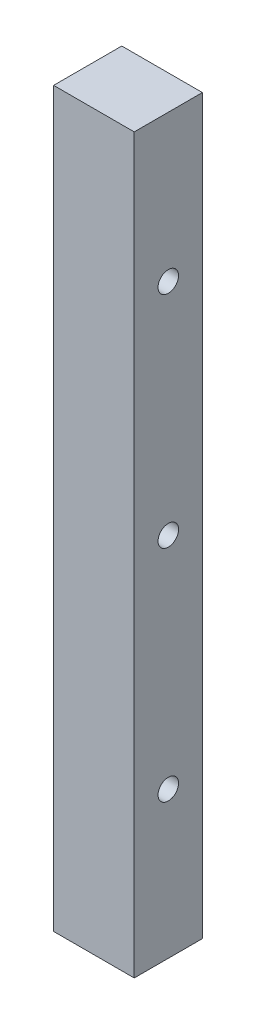
from build123d import *

# Parameters (mm, degrees)
SKETCH1_W           = 13.97
SKETCH1_H           = 127
BOSS_EXTRUDE1_DEPTH = 11.811
SKETCH2_R           = 1.778
CUT_EXTRUDE1_DEPTH  = 129.310796977


with BuildPart() as part:
    # Sketch1 → Boss-Extrude1 (new body)
    with BuildSketch(Plane.XY):
        with Locations((6.985, 63.5)):
            Rectangle(SKETCH1_W, SKETCH1_H)
    extrude(amount=BOSS_EXTRUDE1_DEPTH)

    # Sketch2 → Cut-Extrude1 (cut, through all)
    with BuildSketch(Plane.ZY):
        with Locations((5.9055, 101.6)):
            Circle(SKETCH2_R)
        with Locations((5.9055, 63.5)):
            Circle(SKETCH2_R)
        with Locations((5.9055, 25.4)):
            Circle(SKETCH2_R)
    extrude(amount=-CUT_EXTRUDE1_DEPTH, mode=Mode.SUBTRACT)


solid = part.part
